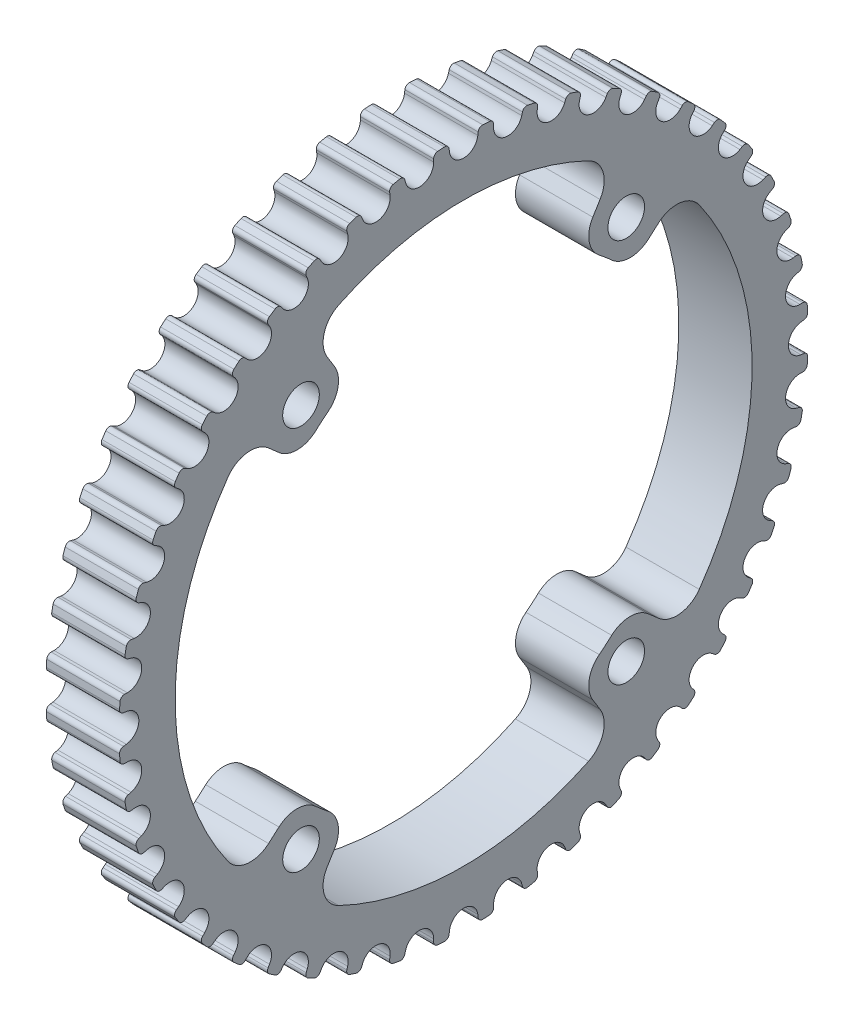
from build123d import *

# Parameters (mm, degrees)
CHAMFER_1_SIZE           = 1
SKETCH_4_W               = 5
SKETCH_4_H               = 2.299999953
CUT_EXTRUDE_1_DEPTH      = 61.124705887
CUT_EXTRUDE_2_REACH      = 62.125
PATTERN_CIRCULAR_3_COUNT = 48
SKETCH_7_R               = 40
CUT_EXTRUDE_3_DEPTH      = 20
SKETCH_17_R              = 2
CUT_EXTRUDE_11_DEPTH     = 10
SKETCH_18_R              = 24
CUT_EXTRUDE_12_DEPTH     = 10
CUT_EXTRUDE_13_DEPTH     = 10
FILLET_2_R               = 3


with BuildPart() as part:
    # 草图1 → 旋转1 (revolve)
    with BuildSketch(Plane.XY, mode=Mode.PRIVATE) as revolve_1_sk:
        Polygon((0, 7.0476), (0, 37.623), (28, 37.623), (28, 14.0952), (20, 14.0952), (20, 7.0476), align=None)
    revolve(revolve_1_sk.sketch.rotate(Axis((0, 0, 0), (1, 0, 0)), 90), axis=Axis((0, 0, 0), (1, 0, 0)))

    # 倒角1
    chamfer_1_edges = [part.edges().sort_by_distance(p)[0] for p in [
        (0, 0, -7.0476),
        (20, 0, -7.0476),
    ]]
    chamfer(chamfer_1_edges, length=CHAMFER_1_SIZE)

    # 草图4 → 切除-拉伸1 (cut, through all)
    with BuildSketch(Plane.ZY):
        with Locations((0, 7.739284138)):
            Rectangle(SKETCH_4_W, SKETCH_4_H)
    extrude(amount=-CUT_EXTRUDE_1_DEPTH, mode=Mode.SUBTRACT)

    # 草图6 → 切除-拉伸2 (cut, up to next)
    with BuildSketch(Plane(origin=(0, 0, 0), x_dir=(0, 0, -1), z_dir=(1, 0, 0)), mode=Mode.PRIVATE) as cut_extrude_2_sk1:
        with BuildLine():
            Line((1.586591976, 37.144160575), (1.548371997, 36.832883824))
            ThreePointArc((1.548371997, 36.832883824), (0, 35.463), (-1.548371997, 36.832883824))
            Line((-1.548371997, 36.832883824), (-1.586591976, 37.144160575))
            ThreePointArc((-1.586591976, 37.144160575), (-1.755066854, 37.453859537), (-2.089674516, 37.564922327))
            ThreePointArc((-2.089674516, 37.564922327), (-2.329261517, 37.550827818), (-2.568753733, 37.535205251))
            Line((-2.568753733, 37.535205251), (-2.765401721, 39.136774594))
            ThreePointArc((-2.765401721, 39.136774594), (0, 39.23435449), (2.765401721, 39.136774594))
            Line((2.765401721, 39.136774594), (2.568753733, 37.535205251))
            ThreePointArc((2.568753733, 37.535205251), (2.329261517, 37.550827818), (2.089674516, 37.564922327))
            ThreePointArc((2.089674516, 37.564922327), (1.755066854, 37.453859537), (1.586591976, 37.144160575))
        make_face()
    cut_extrude_2_tool1 = extrude(cut_extrude_2_sk1.sketch, amount=CUT_EXTRUDE_2_REACH, mode=Mode.PRIVATE) & part.part
    cut_extrude_2 = cut_extrude_2_tool1.solids().sort_by_distance((0, 37.715945, 0))[0]
    add(cut_extrude_2, mode=Mode.SUBTRACT)

    # 阵列(圆周)3: 切除-拉伸2 ×48 about axis
    pattern_circular_3_axis = Axis((0, 0, 0), (1, 0, 0))
    for i in range(1, PATTERN_CIRCULAR_3_COUNT):
        add(cut_extrude_2.rotate(pattern_circular_3_axis, i * 360 / PATTERN_CIRCULAR_3_COUNT), mode=Mode.SUBTRACT)

    # 草图7 → 切除-拉伸3 (cut)
    with BuildSketch(Plane(origin=(28, 0, 0), x_dir=(0, 0, -1), z_dir=(1, 0, 0))):
        Circle(SKETCH_7_R)
    extrude(amount=-CUT_EXTRUDE_3_DEPTH, mode=Mode.SUBTRACT)

    # 草图17 → 切除-拉伸11 (cut)
    with BuildSketch(Plane(origin=(8, 0, 0), x_dir=(0, 0, -1), z_dir=(1, 0, 0))):
        with Locations((17.755280905, -21)):
            Circle(SKETCH_17_R)
        with Locations((-17.755280905, -21)):
            Circle(SKETCH_17_R)
        with Locations((-17.755280905, 21)):
            Circle(SKETCH_17_R)
        with Locations((17.755280905, 21)):
            Circle(SKETCH_17_R)
    extrude(amount=-CUT_EXTRUDE_11_DEPTH, mode=Mode.SUBTRACT)

    # 草图18 → 切除-拉伸12 (cut)
    with BuildSketch(Plane(origin=(8, 0, 0), x_dir=(0, 0, -1), z_dir=(1, 0, 0))):
        Circle(SKETCH_18_R)
    extrude(amount=-CUT_EXTRUDE_12_DEPTH, mode=Mode.SUBTRACT)

    # 草图19 → 切除-拉伸13 (cut)
    with BuildSketch(Plane(origin=(8, 0, 0), x_dir=(0, 0, -1), z_dir=(1, 0, 0))):
        with BuildLine():
            ThreePointArc((24, 0), (22.459097858, -8.461023779), (18.034256384, -15.835580086))
            Line((18.034256384, -15.835580086), (23.669961504, -20.784198863))
            ThreePointArc((23.669961504, -20.784198863), (29.477565939, -11.10509371), (31.5, 0))
            ThreePointArc((31.5, 0), (29.477565939, 11.10509371), (23.669961504, 20.784198863))
            Line((23.669961504, 20.784198863), (18.034256384, 15.835580086))
            ThreePointArc((18.034256384, 15.835580086), (22.459097858, 8.461023779), (24, 0))
        make_face()
        with BuildLine():
            Line((16.558985107, -26.796455218), (12.616369605, -20.416346832))
            ThreePointArc((12.616369605, -20.416346832), (0, -24), (-12.616369605, -20.416346832))
            Line((-12.616369605, -20.416346832), (-16.558985107, -26.796455218))
            ThreePointArc((-16.558985107, -26.796455218), (0, -31.5), (16.558985107, -26.796455218))
        make_face()
        with BuildLine():
            Line((-23.669961504, -20.784198863), (-18.034256384, -15.835580086))
            ThreePointArc((-18.034256384, -15.835580086), (-24, 0), (-18.034256384, 15.835580086))
            Line((-18.034256384, 15.835580086), (-23.669961504, 20.784198863))
            ThreePointArc((-23.669961504, 20.784198863), (-31.5, 0), (-23.669961504, -20.784198863))
        make_face()
        with BuildLine():
            ThreePointArc((-12.616369605, 20.416346832), (0, 24), (12.616369605, 20.416346832))
            Line((12.616369605, 20.416346832), (16.558985107, 26.796455218))
            ThreePointArc((16.558985107, 26.796455218), (0, 31.5), (-16.558985107, 26.796455218))
            Line((-16.558985107, 26.796455218), (-12.616369605, 20.416346832))
        make_face()
    extrude(amount=-CUT_EXTRUDE_13_DEPTH, mode=Mode.SUBTRACT)

    # 圆角2
    fillet_2_edges = [part.edges().sort_by_distance(p)[0] for p in [
        (4, -20.416346832, 12.616369605),
        (4, -20.416346832, -12.616369605),
        (4, 15.835580086, 18.034256384),
        (4, -15.835580086, 18.034256384),
        (4, 20.416346832, -12.616369605),
        (4, 20.416346832, 12.616369605),
        (4, -15.835580086, -18.034256384),
        (4, 15.835580086, -18.034256384),
        (4, 20.784198863, -23.669961504),
        (4, -20.784198863, -23.669961504),
        (4, 26.796455218, 16.558985107),
        (4, 26.796455218, -16.558985107),
        (4, -20.784198863, 23.669961504),
        (4, 20.784198863, 23.669961504),
        (4, -26.796455218, -16.558985107),
        (4, -26.796455218, 16.558985107),
    ]]
    fillet(fillet_2_edges, radius=FILLET_2_R)


solid = part.part
